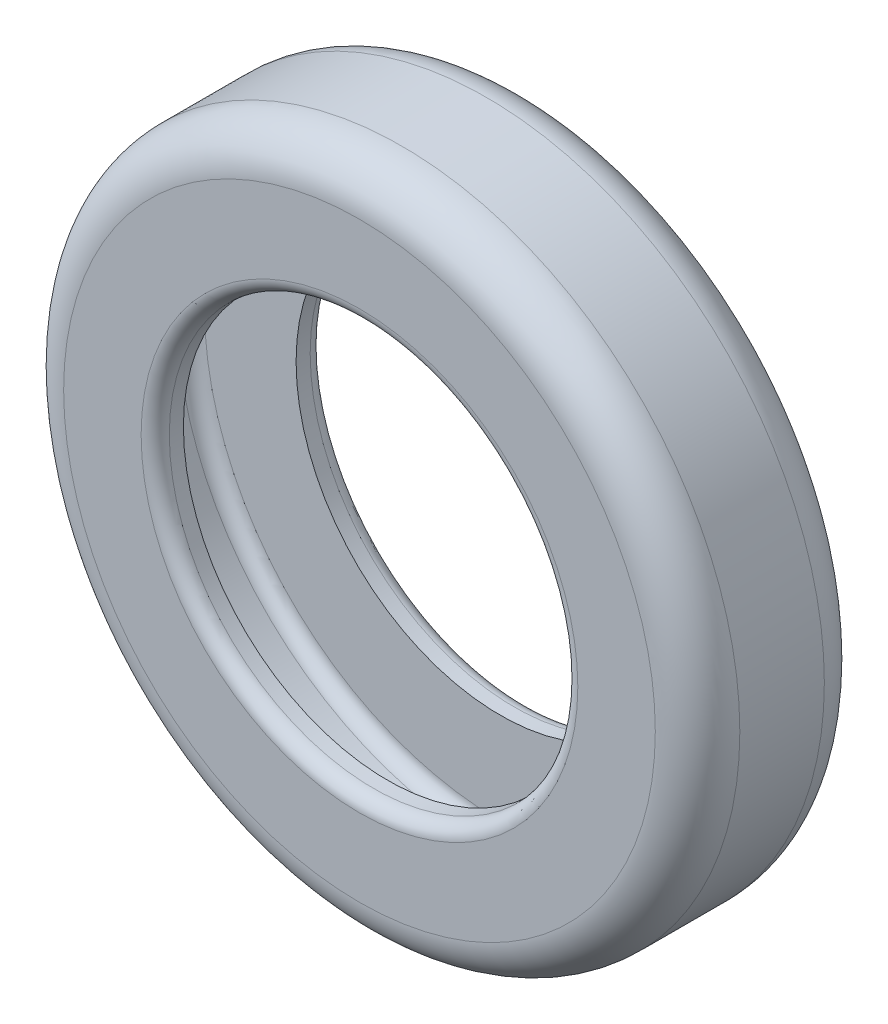
from build123d import *

# Parameters (mm, degrees)
SKETCH1_R           = 240
SKETCH1_R_2         = 145
EXTRUDE_THIN1_DEPTH = 120
FILLET1_R           = 30
FILLET2_R           = 10
FILLET3_R           = 10


# Read off the part's stored shape, not the designer's step: Shell1
with BuildPart() as part:
    # Sketch1 → Extrude-Thin1 (new body)
    with BuildSketch(Plane.XY):
        Circle(SKETCH1_R)
        Circle(SKETCH1_R_2, mode=Mode.SUBTRACT)
    extrude(amount=-EXTRUDE_THIN1_DEPTH)

    # Fillet1
    fillet1_edges = [part.edges().sort_by_distance(p)[0] for p in [
        (-240, 0, 0),
        (-240, 0, -120),
    ]]
    fillet(fillet1_edges, radius=FILLET1_R)

    # Fillet2
    fillet2_edges = [part.edges().sort_by_distance(p)[0] for p in [
        (-145, 0, 0),
    ]]
    fillet(fillet2_edges, radius=FILLET2_R)

    # Fillet3
    fillet3_edges = [part.edges().sort_by_distance(p)[0] for p in [
        (-145, 0, -120),
    ]]
    fillet(fillet3_edges, radius=FILLET3_R)

    # Shell1 outline → Shell1 (revolve, cut)
    with BuildSketch(Plane.XZ):
        with BuildLine():
            ThreePointArc((210, -100), (217.071067812, -97.071067812), (220, -90))
            Line((220, -90), (220, -30))
            ThreePointArc((220, -30), (217.071067812, -22.928932188), (210, -20))
            Line((210, -20), (145, -20))
            Line((145, -20), (145, -100))
            Line((145, -100), (210, -100))
        make_face()
    revolve(axis=Axis((0, 0, 0), (0, 0, 1)), mode=Mode.SUBTRACT)


solid = part.part
